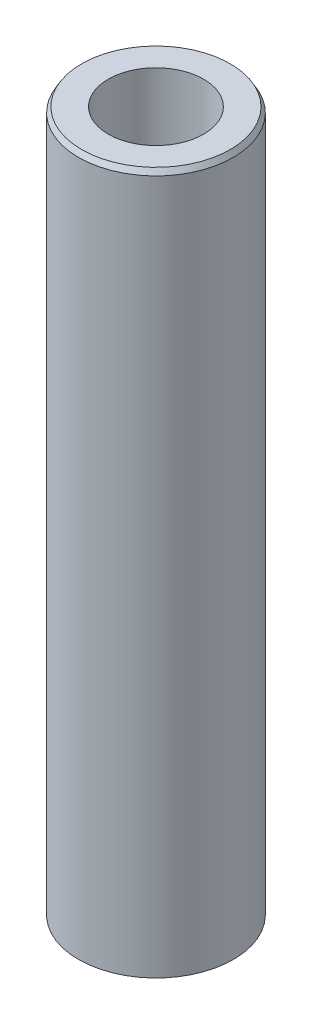
from build123d import *
from OCP.BRepFilletAPI import BRepFilletAPI_MakeChamfer

# Parameters (mm, degrees)
SKETCH1_R           = 10
BOSS_EXTRUDE1_DEPTH = 90.85744086
SKETCH2_R           = 6.163350953
CUT_EXTRUDE1_DEPTH  = 92.951479377
CHAMFER1_SIZE       = 0.683916434
CHAMFER1_SIZE2      = 0.394859337


with BuildPart() as part:
    # Sketch1 → Boss-Extrude1 (new body)
    with BuildSketch(Plane(origin=(0, 0, 0), x_dir=(1, 0, 0), z_dir=(0, 1, 0))):
        Circle(SKETCH1_R)
    extrude(amount=BOSS_EXTRUDE1_DEPTH)

    # Sketch2 → Cut-Extrude1 (cut, through all)
    with BuildSketch(Plane(origin=(0, 0, 0), x_dir=(1, 0, 0), z_dir=(0, 1, 0))):
        Circle(SKETCH2_R)
    extrude(amount=CUT_EXTRUDE1_DEPTH, mode=Mode.SUBTRACT)

    # Chamfer1: one chamfer whose edges measure the first distance from different faces: ONE call of the kernel's chamfer builder (chamfer() names one face for all edges)
    chamfer1_edges_1 = [part.edges().sort_by_distance(p)[0] for p in [
        (-10, 90.85744086, 0),
    ]]
    chamfer1_side_1 = [part.faces().sort_by_distance(p)[0] for p in [
        (-10, 45.42872043, 0),
    ]]
    chamfer1_edges_2 = [part.edges().sort_by_distance(p)[0] for p in [
        (-10, 0, 0),
    ]]
    chamfer1_side_2 = [part.faces().sort_by_distance(p)[0] for p in [
        (-9.717157288, 0, 0),
    ]]
    chamfer1 = BRepFilletAPI_MakeChamfer(part.part.solid().wrapped)
    for e in chamfer1_edges_1:
        chamfer1.Add(CHAMFER1_SIZE, CHAMFER1_SIZE2, e.wrapped, chamfer1_side_1[0].wrapped)  # the first distance lies on this face
    for e in chamfer1_edges_2:
        chamfer1.Add(CHAMFER1_SIZE, CHAMFER1_SIZE2, e.wrapped, chamfer1_side_2[0].wrapped)  # the first distance lies on this face
    add(Compound.cast(chamfer1.Shape()), mode=Mode.REPLACE)


solid = part.part
